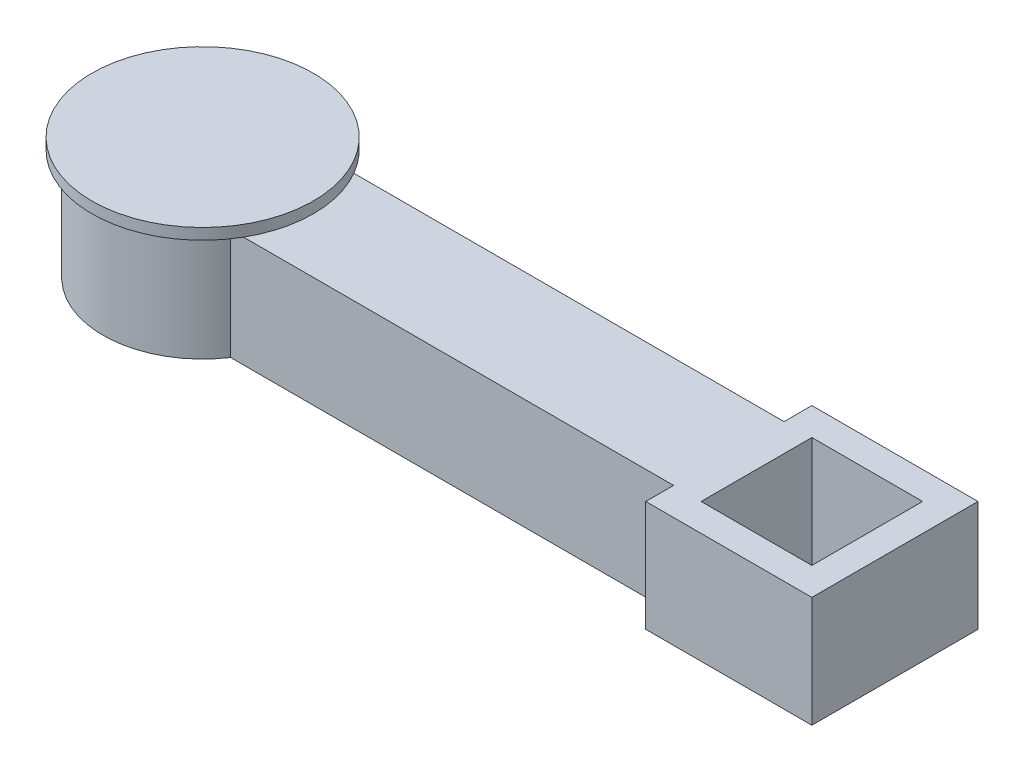
from build123d import *

# Parameters (mm, degrees)
BOSS_EXTRUDE1_DEPTH = 100
SKETCH5_R           = 70
CUT_EXTRUDE2_DEPTH  = 100
SKETCH6_R           = 100
BOSS_EXTRUDE4_DEPTH = 10
SKETCH7_W           = 100
SKETCH7_H           = 100
CUT_EXTRUDE3_DEPTH  = 100


with BuildPart() as part:
    # Sketch1 → Boss-Extrude1 (new body)
    with BuildSketch(Plane(origin=(0, 0, 0), x_dir=(1, 0, 0), z_dir=(0, 1, 0))):
        with BuildLine():
            Line((163.145565834, 275.992438563), (163.145565834, 275.741810419))
            ThreePointArc((163.145565834, 275.741810419), (-1.854434166, 225.992438563), (163.145565834, 176.243066708))
            Line((163.145565834, 176.243066708), (563.145565834, 176.243066708))
            Line((563.145565834, 176.243066708), (563.145565834, 151.117752636))
            Line((563.145565834, 151.117752636), (713.145565834, 151.117752636))
            Line((713.145565834, 151.117752636), (713.145565834, 301.117752636))
            Line((713.145565834, 301.117752636), (563.145565834, 301.117752636))
            Line((563.145565834, 301.117752636), (563.145565834, 275.992438563))
            Line((563.145565834, 275.992438563), (163.145565834, 275.992438563))
        make_face()
    extrude(amount=BOSS_EXTRUDE1_DEPTH)

    # Sketch5 → Cut-Extrude2 (cut)
    with BuildSketch(Plane(origin=(0, 100, 0), x_dir=(1, 0, 0), z_dir=(0, 1, 0))):
        with Locations((88.145565834, 225.992438563)):
            Circle(SKETCH5_R)
    extrude(amount=-CUT_EXTRUDE2_DEPTH, mode=Mode.SUBTRACT)

    # Sketch6 → Boss-Extrude4 (add)
    with BuildSketch(Plane(origin=(0, 100, 0), x_dir=(1, 0, 0), z_dir=(0, 1, 0))):
        with Locations((88.145565834, 225.992438563)):
            Circle(SKETCH6_R)
    extrude(amount=BOSS_EXTRUDE4_DEPTH)

    # Sketch7 → Cut-Extrude3 (cut)
    with BuildSketch(Plane(origin=(0, 100, 0), x_dir=(1, 0, 0), z_dir=(0, 1, 0))):
        with Locations((638.145565834, 226.117752636)):
            Rectangle(SKETCH7_W, SKETCH7_H)
    extrude(amount=-CUT_EXTRUDE3_DEPTH, mode=Mode.SUBTRACT)


solid = part.part
